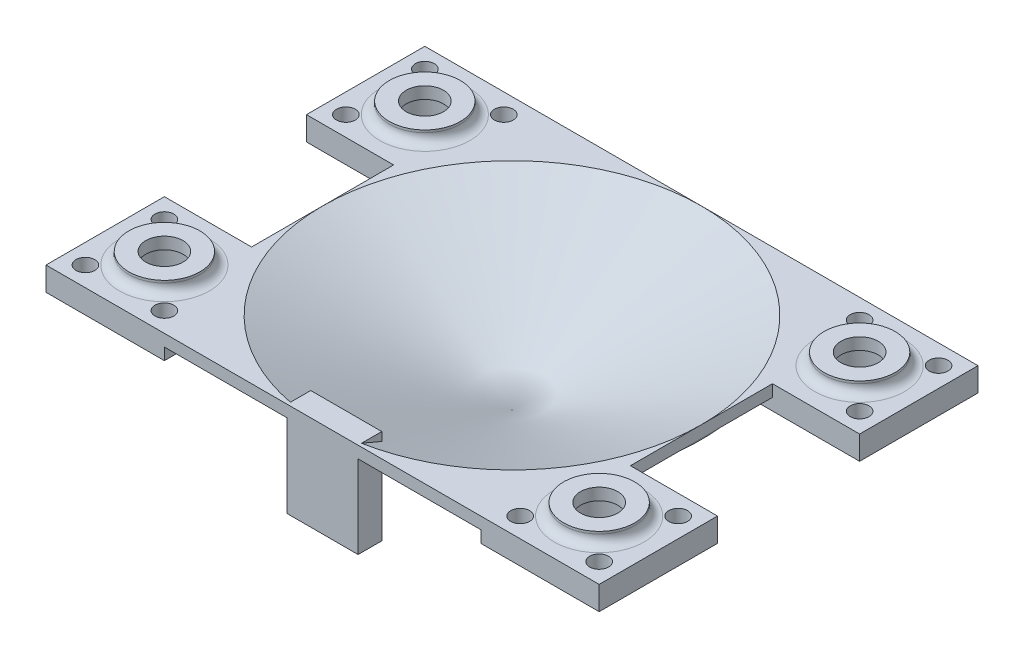
from build123d import *

# Parameters (mm, degrees)
BOSS_EXTRUDE1_START                  = -3.175
BOSS_EXTRUDE1_DEPTH                  = 3.175
SKETCH4_W                            = 31.75
SKETCH4_H                            = 31.75
SKETCH4_R                            = 7.5
BOSS_EXTRUDE2_DEPTH                  = 6.35
CUT_EXTRUDE1_REACH                   = 95.422
F_8_0_199_DIAMETER_HOLE1_D           = 5.0546
F_8_0_199_DIAMETER_HOLE1_CSINK_D     = 6.3246
F_8_0_199_DIAMETER_HOLE1_CSINK_ANGLE = 90
MIRROR4_COPY_1_SKETCH_W              = 31.75
MIRROR4_COPY_1_SKETCH_H              = 31.75
MIRROR4_COPY_1_SKETCH_R              = 7.5
MIRROR4_COPY_1_DEPTH                 = 6.35
MIRROR4_COPY_2_REACH                 = 95.422
MIRROR4_COPY_3_D                     = 5.0546
MIRROR4_COPY_3_CSINK_D               = 6.3246
MIRROR4_COPY_3_CSINK_ANGLE           = 90
SKETCH7_R                            = 9.525
SKETCH7_R_2                          = 5
BOSS_EXTRUDE3_DEPTH                  = 3.175
FILLET1_R                            = 2.54
SKETCH8_W                            = 19.05
SKETCH8_H                            = 25.4
BOSS_EXTRUDE4_DEPTH                  = 6.35


with BuildPart() as part:
    # Sketch1 → Revolve1 (revolve)
    with BuildSketch(Plane.XY):
        Polygon((0, -21.941501914), (-50.8, 0), (-50.8, -3.458498086), (0, -25.4), align=None)
    revolve(axis=Axis((0, -55, 0), (0, 1, 0)))

    # Sketch3 → Boss-Extrude1 (add)
    with BuildSketch(Plane(origin=(0, 0, 0), x_dir=(1, 0, 0), z_dir=(0, 1, 0)).offset(BOSS_EXTRUDE1_START)):
        with BuildLine():
            Line((-50.8, 8e-09), (-50.8, -50.8))
            Line((-50.8, -50.8), (0, -50.8))
            ThreePointArc((0, -50.8), (-35.921024487, -35.921024482), (-50.8, 8e-09))
        make_face()
        with BuildLine():
            ThreePointArc((50.8, 0), (35.921024484, -35.921024484), (0, -50.8))
            Line((0, -50.8), (50.8, -50.8))
            Line((50.8, -50.8), (50.8, 0))
        make_face()
        with BuildLine():
            Line((-50.8, 50.8), (-50.8, 8e-09))
            ThreePointArc((-50.8, 8e-09), (-35.921024463, 35.921024505), (5.1e-08, 50.8))
            Line((5.1e-08, 50.8), (-50.8, 50.8))
        make_face()
        with BuildLine():
            ThreePointArc((5.1e-08, 50.8), (35.921024502, 35.921024466), (50.8, 0))
            Line((50.8, 0), (50.8, 50.8))
            Line((50.8, 50.8), (5.1e-08, 50.8))
        make_face()
    extrude(amount=BOSS_EXTRUDE1_DEPTH)

    # Sketch4 → Boss-Extrude2 (add)
    with BuildSketch(Plane(origin=(0, 0, 0), x_dir=(1, 0, 0), z_dir=(0, 1, 0))):
        with Locations((-58.3, -34.925)):
            Rectangle(SKETCH4_W, SKETCH4_H)
        with Locations((-58.3, -34.925)):
            Circle(SKETCH4_R, mode=Mode.SUBTRACT)
    boss_extrude2 = extrude(amount=-BOSS_EXTRUDE2_DEPTH)

    # Cut-Extrude1: up to this cone (the profile starts inside it)
    cut_extrude1_end = Plane(origin=(0, 0, 0), z_dir=(0, 1, 0)).offset(-21.941500914) * Cone(2.315e-06, 390.497693855, 168.663500914, align=(Align.CENTER, Align.CENTER, Align.MIN), mode=Mode.PRIVATE)
    # Sketch4<4> → Cut-Extrude1 (cut, up to the surface)
    with BuildSketch(Plane(origin=(0, 0, 0), x_dir=(1, 0, 0), z_dir=(0, 1, 0)), mode=Mode.PRIVATE) as cut_extrude1_sk1:
        with BuildLine():
            Line((-42.425, -19.05), (-47.092860393, -19.05))
            ThreePointArc((-47.092860393, -19.05), (-44.979207057, -23.611669415), (-42.425, -27.942071774))
            Line((-42.425, -27.942071774), (-42.425, -19.05))
        make_face()
    cut_extrude1_tool1 = extrude(cut_extrude1_sk1.sketch, amount=-CUT_EXTRUDE1_REACH, mode=Mode.PRIVATE) & cut_extrude1_end
    cut_extrude1 = cut_extrude1_tool1.solids().sort_by_distance((-44.045331, 0, 22.12762))[0]
    add(cut_extrude1, mode=Mode.SUBTRACT)

    # #8 (0.199) Diameter Hole1 (through all)
    with Locations(Plane(origin=(0, -6.35, 0), x_dir=(-1, 0, 0), z_dir=(0, -1, 0))):
        with Locations((68.889150429, -24.335849571), (68.889150429, -45.514150429), (47.710849571, -45.514150429)):
            f_8_0_199_diameter_hole1 = CounterSinkHole(F_8_0_199_DIAMETER_HOLE1_D / 2, F_8_0_199_DIAMETER_HOLE1_CSINK_D / 2, counter_sink_angle=F_8_0_199_DIAMETER_HOLE1_CSINK_ANGLE)

    # Mirror3: Boss-Extrude2, Cut-Extrude1, #8 (0.199) Diameter Hole1 across plane
    add(boss_extrude2.mirror(Plane.XY))
    add(cut_extrude1.mirror(Plane.XY), mode=Mode.SUBTRACT)
    add(f_8_0_199_diameter_hole1.mirror(Plane.XY), mode=Mode.SUBTRACT)

    # Mirror4: Boss-Extrude2, Cut-Extrude1, #8 (0.199) Diameter Hole1 across plane
    add(boss_extrude2.mirror(Plane(origin=(0, 0, 0), x_dir=(0, 0, 1), z_dir=(1, 0, 0))))
    add(cut_extrude1.mirror(Plane(origin=(0, 0, 0), x_dir=(0, 0, 1), z_dir=(1, 0, 0))), mode=Mode.SUBTRACT)
    add(f_8_0_199_diameter_hole1.mirror(Plane(origin=(0, 0, 0), x_dir=(0, 0, 1), z_dir=(1, 0, 0))), mode=Mode.SUBTRACT)

    # Mirror4 copy 1 sketch → Mirror4 copy 1 (add)
    with BuildSketch(Plane(origin=(0, 0, 0), x_dir=(-1, 0, 0), z_dir=(0, 1, 0))):
        with Locations((-58.3, -34.925)):
            Rectangle(MIRROR4_COPY_1_SKETCH_W, MIRROR4_COPY_1_SKETCH_H)
        with Locations((-58.3, -34.925)):
            Circle(MIRROR4_COPY_1_SKETCH_R, mode=Mode.SUBTRACT)
    extrude(amount=-MIRROR4_COPY_1_DEPTH)

    # Mirror4 copy 2: up to this cone (the profile starts inside it)
    mirror4_copy_2_end = Plane(origin=(0, 0, 0), z_dir=(0, 1, 0)).offset(-21.941500914) * Cone(2.315e-06, 390.497693855, 168.663500914, align=(Align.CENTER, Align.CENTER, Align.MIN), mode=Mode.PRIVATE)
    # Mirror4 copy 2 sketch → Mirror4 copy 2 (cut, up to the surface)
    with BuildSketch(Plane(origin=(0, 0, 0), x_dir=(-1, 0, 0), z_dir=(0, 1, 0)), mode=Mode.PRIVATE) as mirror4_copy_2_sk1:
        with BuildLine():
            Line((-42.425, -19.05), (-47.092860393, -19.05))
            ThreePointArc((-47.092860393, -19.05), (-44.979207057, -23.611669415), (-42.425, -27.942071774))
            Line((-42.425, -27.942071774), (-42.425, -19.05))
        make_face()
    mirror4_copy_2_tool1 = extrude(mirror4_copy_2_sk1.sketch, amount=-MIRROR4_COPY_2_REACH, mode=Mode.PRIVATE) & mirror4_copy_2_end
    add(mirror4_copy_2_tool1.solids().sort_by_distance((-44.045331, 0, 22.12762))[0], mode=Mode.SUBTRACT)

    # Mirror4 copy 3 (through all)
    with Locations(Plane.XZ.offset(6.35)):
        with Locations((68.889150429, -24.335849571), (68.889150429, -45.514150429), (47.710849571, -45.514150429)):
            CounterSinkHole(MIRROR4_COPY_3_D / 2, MIRROR4_COPY_3_CSINK_D / 2, counter_sink_angle=MIRROR4_COPY_3_CSINK_ANGLE)

    # Sketch7 → Boss-Extrude3 (add)
    # profile 1 of 4: a face of its own
    with BuildSketch(Plane(origin=(0, 0, 0), x_dir=(1, 0, 0), z_dir=(0, 1, 0))):
        with Locations((-58.3, 34.925)):
            Circle(SKETCH7_R)
        with Locations((-58.3, 34.925)):
            Circle(SKETCH7_R_2, mode=Mode.SUBTRACT)
    # profile 2 of 4: a face of its own
    with BuildSketch(Plane(origin=(0, 0, 0), x_dir=(1, 0, 0), z_dir=(0, 1, 0))):
        with Locations((-58.3, -34.925)):
            Circle(SKETCH7_R)
        with Locations((-58.3, -34.925)):
            Circle(SKETCH7_R_2, mode=Mode.SUBTRACT)
    # profile 3 of 4: a face of its own
    with BuildSketch(Plane(origin=(0, 0, 0), x_dir=(1, 0, 0), z_dir=(0, 1, 0))):
        with Locations((58.3, -34.925)):
            Circle(SKETCH7_R)
        with Locations((58.3, -34.925)):
            Circle(SKETCH7_R_2, mode=Mode.SUBTRACT)
    # profile 4 of 4: a face of its own
    with BuildSketch(Plane(origin=(0, 0, 0), x_dir=(1, 0, 0), z_dir=(0, 1, 0))):
        with Locations((58.3, 34.925)):
            Circle(SKETCH7_R)
        with Locations((58.3, 34.925)):
            Circle(SKETCH7_R_2, mode=Mode.SUBTRACT)
    extrude(amount=BOSS_EXTRUDE3_DEPTH)

    # Fillet1
    fillet1_edges = [part.edges().sort_by_distance(p)[0] for p in [
        (48.775, 0, 34.925),
        (48.775, 0, -34.925),
        (-67.825, 0, 34.925),
        (-67.825, 0, -34.925),
    ]]
    fillet(fillet1_edges, radius=FILLET1_R)

    # Sketch8 → Boss-Extrude4 (add)
    with BuildSketch(Plane(origin=(0, 0, 50.8), x_dir=(-1, 0, 0), z_dir=(0, 0, -1))):
        with Locations((0, -12.7)):
            Rectangle(SKETCH8_W, SKETCH8_H)
    extrude(amount=BOSS_EXTRUDE4_DEPTH)


solid = part.part
